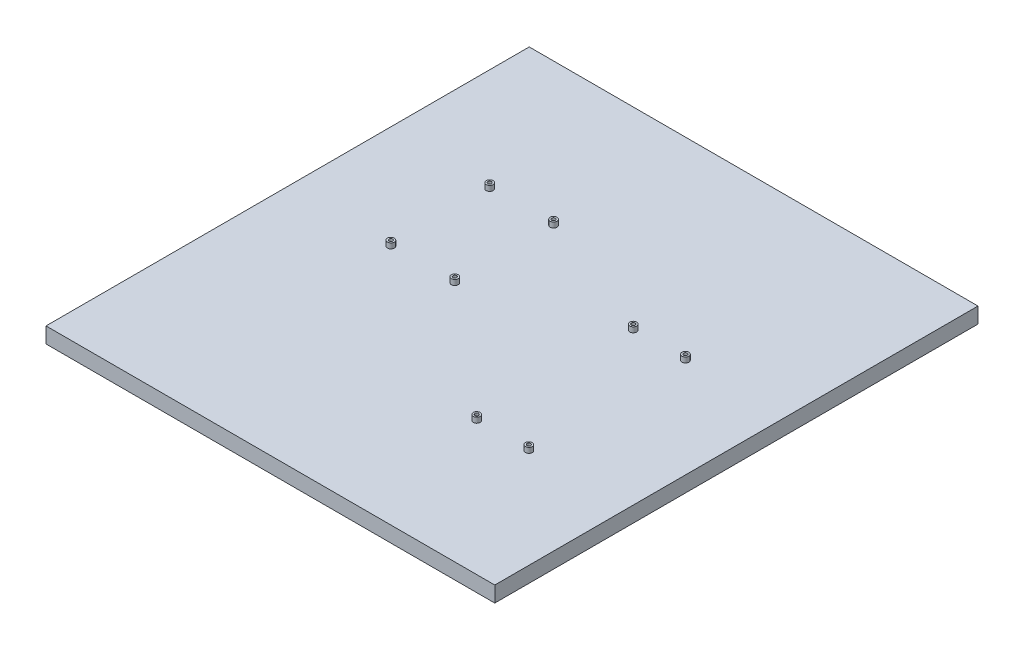
from build123d import *

# Parameters (mm, degrees)
SKETCH1_W           = 430
SKETCH1_H           = 463
BOSS_EXTRUDE1_DEPTH = 15
SKETCH7_R           = 3.3
BOSS_EXTRUDE2_DEPTH = 5
SKETCH8_R           = 1.75
CUT_EXTRUDE1_DEPTH  = 4
SKETCH6_R           = 3.3
BOSS_EXTRUDE3_DEPTH = 5
SKETCH10_R          = 1.75
CUT_EXTRUDE2_DEPTH  = 4
SKETCH12_R          = 3.8
CUT_EXTRUDE3_DEPTH  = 10


with BuildPart() as part:
    # Sketch1 → Boss-Extrude1 (new body)
    with BuildSketch(Plane(origin=(0, 0, 0), x_dir=(1, 0, 0), z_dir=(0, 1, 0))):
        Rectangle(SKETCH1_W, SKETCH1_H)
    extrude(amount=BOSS_EXTRUDE1_DEPTH)

    # Sketch7 → Boss-Extrude2 (add)
    with BuildSketch(Plane(origin=(0, 15, 0), x_dir=(1, 0, 0), z_dir=(0, 1, 0))):
        with Locations((-116.362714529, 94.945868521)):
            Circle(SKETCH7_R)
        with Locations((-55.363204635, 95.191638193)):
            Circle(SKETCH7_R)
        with Locations((-54.980448566, 0.192396061)):
            Circle(SKETCH7_R)
        with Locations((-115.97995846, -0.053373612)):
            Circle(SKETCH7_R)
    extrude(amount=BOSS_EXTRUDE2_DEPTH)

    # Sketch8 → Cut-Extrude1 (cut)
    with BuildSketch(Plane(origin=(0, 20, 0), x_dir=(1, 0, 0), z_dir=(0, 1, 0))):
        with Locations((-54.980448566, 0.192396061)):
            Circle(SKETCH8_R)
        with Locations((-55.363204635, 95.191638193)):
            Circle(SKETCH8_R)
        with Locations((-116.362714529, 94.945868521)):
            Circle(SKETCH8_R)
        with Locations((-115.97995846, -0.053373612)):
            Circle(SKETCH8_R)
    extrude(amount=-CUT_EXTRUDE1_DEPTH, mode=Mode.SUBTRACT)

    # Sketch6 → Boss-Extrude3 (add)
    with BuildSketch(Plane(origin=(0, 15, 0), x_dir=(1, 0, 0), z_dir=(0, 1, 0))):
        with Locations((119.793345796, 46.373061352)):
            Circle(SKETCH6_R)
        with Locations((69.793345796, 46.373061352)):
            Circle(SKETCH6_R)
        with Locations((119.793345796, -103.626938648)):
            Circle(SKETCH6_R)
        with Locations((69.793345796, -103.626938648)):
            Circle(SKETCH6_R)
    extrude(amount=BOSS_EXTRUDE3_DEPTH)

    # Sketch10 → Cut-Extrude2 (cut)
    with BuildSketch(Plane(origin=(0, 20, 0), x_dir=(1, 0, 0), z_dir=(0, 1, 0))):
        with Locations((69.793345796, 46.373061352)):
            Circle(SKETCH10_R)
        with Locations((119.793345796, 46.373061352)):
            Circle(SKETCH10_R)
        with Locations((119.793345796, -103.626938648)):
            Circle(SKETCH10_R)
        with Locations((69.793345796, -103.626938648)):
            Circle(SKETCH10_R)
    extrude(amount=-CUT_EXTRUDE2_DEPTH, mode=Mode.SUBTRACT)

    # Sketch12 → Cut-Extrude3 (cut)
    with BuildSketch(Plane(origin=(0, 0, 0), x_dir=(-1, 0, 0), z_dir=(0, -1, 0))):
        with Locations((-183.528683765, -175)):
            Circle(SKETCH12_R)
        with Locations((-203.398904111, 170)):
            Circle(SKETCH12_R)
        with Locations((-183.528683765, 10)):
            Circle(SKETCH12_R)
        with Locations((-203.398904111, 10)):
            Circle(SKETCH12_R)
        with Locations((-203.398904111, -175)):
            Circle(SKETCH12_R)
        with Locations((-183.528683765, 170)):
            Circle(SKETCH12_R)
        with Locations((206.525269648, -175)):
            Circle(SKETCH12_R)
        with Locations((206.525269648, 20)):
            Circle(SKETCH12_R)
        with Locations((186.44692003, 175)):
            Circle(SKETCH12_R)
        with Locations((206.52526965, 175)):
            Circle(SKETCH12_R)
        with Locations((186.44692003, -175)):
            Circle(SKETCH12_R)
        with Locations((186.446920025, 20)):
            Circle(SKETCH12_R)
        with Locations((160.349922153, -221.520559324)):
            Circle(SKETCH12_R)
        with Locations((160.349922153, -201.54839577)):
            Circle(SKETCH12_R)
        with Locations((20, -221.520559324)):
            Circle(SKETCH12_R)
        with Locations((20, -201.548395767)):
            Circle(SKETCH12_R)
        with Locations((-20, -201.54839577)):
            Circle(SKETCH12_R)
        with Locations((-20, -221.52055932)):
            Circle(SKETCH12_R)
        with Locations((-160, -221.52055932)):
            Circle(SKETCH12_R)
        with Locations((-160, -201.54839577)):
            Circle(SKETCH12_R)
        with Locations((160, 201.06768193)):
            Circle(SKETCH12_R)
        with Locations((160, 221.0363788)):
            Circle(SKETCH12_R)
        with Locations((20, 201.06768193)):
            Circle(SKETCH12_R)
        with Locations((20, 221.0363788)):
            Circle(SKETCH12_R)
        with Locations((-20, 201.06768193)):
            Circle(SKETCH12_R)
        with Locations((-20, 221.0363788)):
            Circle(SKETCH12_R)
        with Locations((-160, 201.067681927)):
            Circle(SKETCH12_R)
        with Locations((-160, 221.036378797)):
            Circle(SKETCH12_R)
    extrude(amount=-CUT_EXTRUDE3_DEPTH, mode=Mode.SUBTRACT)


solid = part.part
